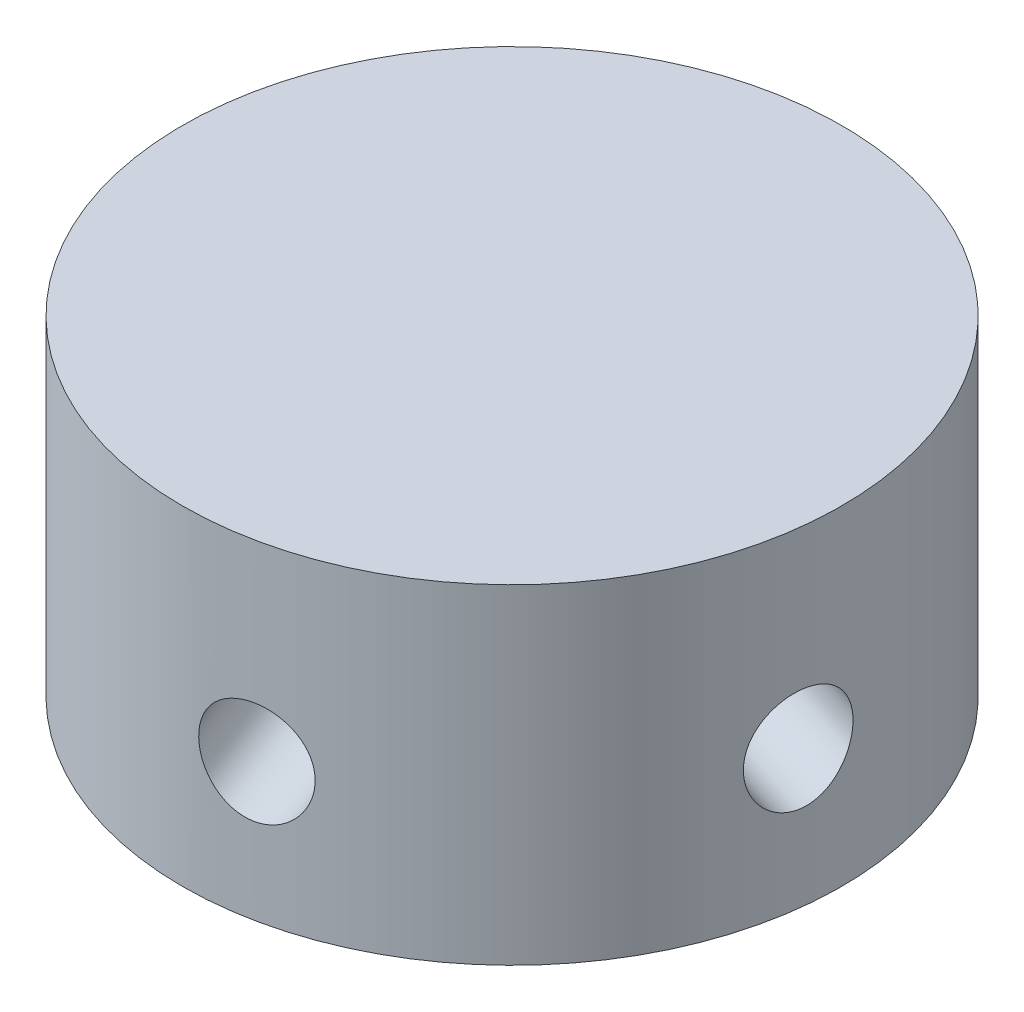
from build123d import *

# Parameters (mm, degrees)
BOSS_EXTRUDE1_DEPTH      = 3
BOSS_EXTRUDE1_DEPTH_BACK = 7
SKETCH1_R                = 10
SKETCH4_R                = 1.5
HOLE_DEPTH               = 19.828402711
HOLECIR_COUNT            = 5
BOSS_EXTRUDE2_DEPTH      = 1


with BuildPart() as part:
    # Sketch1 → Boss-Extrude1 (new, two sides: drawn at the far end of the back side and taken through both)
    with BuildSketch(Plane(origin=(0, 0, 0), x_dir=(1, 0, 0), z_dir=(0, 1, 0)).offset(-BOSS_EXTRUDE1_DEPTH_BACK)):
        Circle(SKETCH1_R)
    extrude(amount=BOSS_EXTRUDE1_DEPTH + BOSS_EXTRUDE1_DEPTH_BACK)

    # Sketch4 → hole (cut, through all)
    with BuildSketch(Plane(origin=(-3.352872105, -1.093066116, 1.887711608), x_dir=(-0.4486862613641547, -0.14627571033740308, -0.8816371449912632), z_dir=(0.8382180262940947, 0.2732665289126682, -0.47192790187872385))):
        Circle(SKETCH4_R)
    hole = extrude(amount=-HOLE_DEPTH, mode=Mode.SUBTRACT)

    # holecir: hole ×5 about axis
    holecir_axis = Axis((0, 5.5, 0), (0, -1, 0))
    for i in range(1, HOLECIR_COUNT):
        add(hole.rotate(holecir_axis, i * 360 / HOLECIR_COUNT), mode=Mode.SUBTRACT)

    # Sketch5 → Boss-Extrude2 (add)
    with BuildSketch(Plane.XZ.offset(7)):
        with BuildLine():
            Line((0.987179487, 3.5), (0.987179487, 3.141025641))
            Line((0.987179487, 3.141025641), (-0.203325321, 3.141025641))
            Line((-0.203325321, 3.141025641), (-0.391927083, 2.220452724))
            add(Edge.make_bspline(
                [(-0.391927083, 2.220452724), (-0.354871209, 2.230682996), (-0.283081313, 2.25050253), (-0.177121452, 2.2725083), (-0.076529249, 2.285773744), (-0.011253878, 2.287585055), (0.020332532, 2.288461538)],
                knots=[0, 0, 0, 0, 1.100273476, 2.13160584, 3.095893838, 4, 4, 4, 4], degree=3))
            add(Edge.make_bspline(
                [(0.020332532, 2.288461538), (0.059416272, 2.287615603), (0.136264669, 2.285952282), (0.248703616, 2.269980432), (0.356036509, 2.244840518), (0.458038879, 2.209719996), (0.55489943, 2.164810263), (0.645726992, 2.108710322), (0.731884905, 2.043176991), (0.811827499, 1.967831979), (0.884351807, 1.884910363), (0.948117796, 1.795752492), (1.002280387, 1.701224829), (1.045841142, 1.600424221), (1.080625476, 1.494465067), (1.103777471, 1.382232485), (1.11919418, 1.264784365), (1.120916566, 1.184479795), (1.121794872, 1.143529647)],
                knots=[0, 0, 0, 0, 1.052922333, 2.070308379, 3.05430497, 4.020497103, 4.973039431, 5.925935799, 6.892292201, 7.88610001, 8.88166317, 9.857072816, 10.836096531, 11.812156883, 12.81219415, 13.836441305, 14.89672472, 16, 16, 16, 16], degree=3))
            add(Edge.make_bspline(
                [(1.121794872, 1.143529647), (1.121129797, 1.115007427), (1.119808634, 1.05834844), (1.113090046, 0.974204239), (1.10015433, 0.891841406), (1.082786606, 0.811249014), (1.060244188, 0.732579642), (1.032955134, 0.655608114), (0.999559107, 0.580813507), (0.962927731, 0.507488112), (0.921681253, 0.437289605), (0.875902746, 0.371640618), (0.827537255, 0.309556337), (0.775495869, 0.251702604), (0.719294874, 0.198459586), (0.659614907, 0.149511304), (0.596932188, 0.104029974), (0.530276946, 0.063861779), (0.461134463, 0.026898823), (0.388506246, -0.003424715), (0.314045545, -0.030535243), (0.23668067, -0.05214477), (0.156586857, -0.069077325), (0.073632082, -0.080577925), (-0.011748588, -0.088954363), (-0.069623601, -0.08947872), (-0.098858173, -0.08974359)],
                knots=[0, 0, 0, 0, 1.056347294, 2.098418968, 3.122841568, 4.141288669, 5.149314143, 6.15115421, 7.162517403, 8.180376062, 9.185164535, 10.17417709, 11.141909838, 12.097768115, 13.052685741, 14.0056014, 14.954263652, 15.917497458, 16.885230207, 17.854509472, 18.828990115, 19.81800267, 20.826176721, 21.857883937, 22.917946725, 24, 24, 24, 24], degree=3))
            add(Edge.make_bspline(
                [(-0.098858173, -0.08974359), (-0.133732354, -0.089052752), (-0.202343184, -0.08769361), (-0.302863752, -0.073475124), (-0.399578357, -0.053111208), (-0.491708458, -0.022474938), (-0.580079722, 0.015912357), (-0.66350244, 0.064428528), (-0.744108216, 0.119407632), (-0.818620253, 0.184287985), (-0.887776366, 0.255203667), (-0.949682875, 0.332161308), (-1.004816452, 0.41389075), (-1.052294199, 0.500788904), (-1.09279222, 0.592627435), (-1.124607208, 0.689750436), (-1.150285563, 0.79165044), (-1.161148984, 0.86180395), (-1.166666667, 0.897435897)],
                knots=[0, 0, 0, 0, 1.0467383, 2.05933395, 3.04377827, 4.011590433, 4.970194871, 5.932262533, 6.905835911, 7.896367577, 8.894135286, 9.877477877, 10.858688626, 11.851381753, 12.8477658, 13.868841284, 14.917554742, 16, 16, 16, 16], degree=3))
            Line((-1.166666667, 0.897435897), (-0.852564103, 0.897435897))
            add(Edge.make_bspline(
                [(-0.852564103, 0.897435897), (-0.844835545, 0.864059445), (-0.829980829, 0.79990805), (-0.79737508, 0.709776709), (-0.757509205, 0.629457485), (-0.710104856, 0.557887902), (-0.653554826, 0.495478905), (-0.589025397, 0.439861843), (-0.516677673, 0.389686713), (-0.436284444, 0.347863946), (-0.351471365, 0.312195193), (-0.262704155, 0.288443498), (-0.172399808, 0.271742605), (-0.111321438, 0.270070844), (-0.080629006, 0.269230769)],
                knots=[0, 0, 0, 0, 1.136247022, 2.183929868, 3.172523383, 4.106158343, 5.02341133, 5.958108904, 6.928429099, 7.938127109, 8.96079061, 9.975095812, 10.982467395, 12, 12, 12, 12], degree=3))
            add(Edge.make_bspline(
                [(-0.080629006, 0.269230769), (-0.050670562, 0.270051547), (0.00831786, 0.271667666), (0.095129247, 0.284106678), (0.178942121, 0.303264249), (0.258929478, 0.331934104), (0.336491017, 0.366778822), (0.409664788, 0.411493898), (0.480567665, 0.462953917), (0.546995799, 0.521910547), (0.607835248, 0.586880241), (0.661591369, 0.656357635), (0.706368282, 0.730474481), (0.744102391, 0.807947634), (0.77275569, 0.889626191), (0.793196671, 0.975127366), (0.80519973, 1.064662347), (0.80685091, 1.125731656), (0.807692308, 1.156850962)],
                knots=[0, 0, 0, 0, 1.027316725, 2.022795036, 3.002884548, 3.971462791, 4.93288096, 5.914575861, 6.907176829, 7.935150275, 8.956128384, 9.956726525, 10.942570165, 11.921478529, 12.907843606, 13.90538589, 14.932640048, 16, 16, 16, 16], degree=3))
            add(Edge.make_bspline(
                [(0.807692308, 1.156850962), (0.807033828, 1.184926713), (0.805744948, 1.239881002), (0.795214378, 1.320280209), (0.776897406, 1.396353251), (0.751473526, 1.468467485), (0.719194018, 1.536690927), (0.679747706, 1.601093987), (0.632394308, 1.660827821), (0.578302419, 1.715920374), (0.519044378, 1.766765249), (0.453600636, 1.810109336), (0.383340709, 1.846573253), (0.309111109, 1.878041252), (0.229146211, 1.900641997), (0.145029578, 1.917609882), (0.05585287, 1.927425245), (-0.005117818, 1.928787134), (-0.036458333, 1.929487179)],
                knots=[0, 0, 0, 0, 1.045622112, 2.046656509, 3.013763289, 3.955457236, 4.890082067, 5.820317437, 6.762574623, 7.722996705, 8.69280354, 9.665887285, 10.63943826, 11.638615906, 12.663482002, 13.728887084, 14.832589034, 16, 16, 16, 16], degree=3))
            add(Edge.make_bspline(
                [(-0.036458333, 1.929487179), (-0.063587262, 1.928906588), (-0.119601617, 1.927707815), (-0.205524444, 1.918881318), (-0.295816167, 1.904642024), (-0.390130663, 1.885055776), (-0.488751171, 1.859424699), (-0.591469572, 1.828710199), (-0.698501838, 1.7919882), (-0.770619563, 1.764255986), (-0.807692308, 1.75)],
                knots=[0, 0, 0, 0, 0.817624296, 1.688186739, 2.600797293, 3.572016777, 4.590301741, 5.671205678, 6.80286297, 8, 8, 8, 8], degree=3))
            Line((-0.807692308, 1.75), (-0.448717949, 3.5))
            Line((-0.448717949, 3.5), (0.987179487, 3.5))
        make_face()
    extrude(amount=BOSS_EXTRUDE2_DEPTH)


solid = part.part
